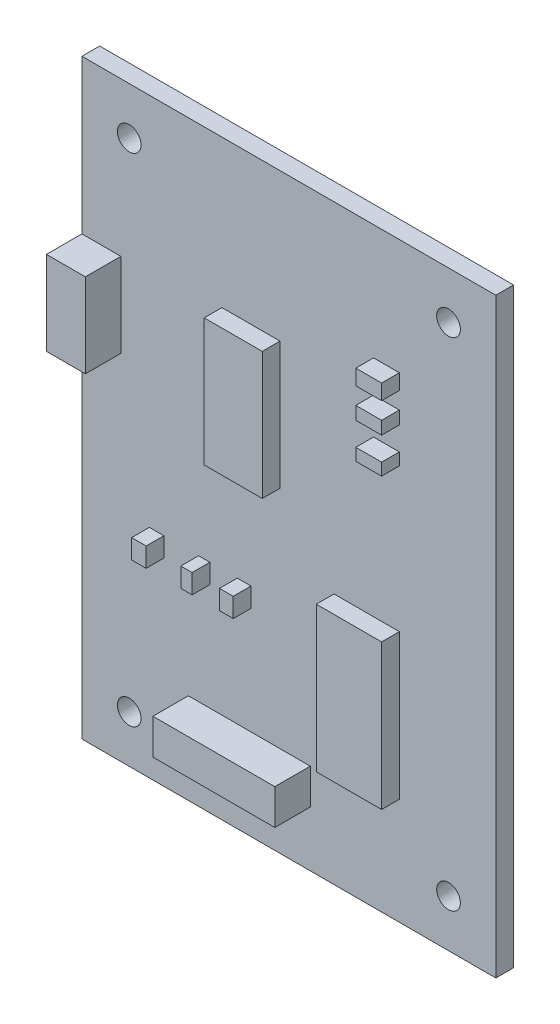
from build123d import *

# Parameters (mm, degrees)
SKETCH_1_W          = 70
SKETCH_1_H          = 100
EXTRUDE_1_DEPTH     = 3
SKETCH_2_R          = 2
CUT_EXTRUDE_1_DEPTH = 123.102416029
SKETCH_3_W          = 9.819716148
SKETCH_3_H          = 21.548821549
SKETCH_3_W_2        = 11.047180667
SKETCH_3_H_2        = 24.549290372
SKETCH_3_W_3        = 2.454929037
SKETCH_3_H_3        = 3.273238716
SKETCH_3_W_4        = 1.909389251
SKETCH_3_W_5        = 2.318544091
SKETCH_3_W_6        = 4.364318288
SKETCH_3_H_4        = 2.045774198
SKETCH_3_H_5        = 2.182159144
SKETCH_3_H_6        = 2.591313983
EXTRUDE_2_DEPTH     = 3
SKETCH_4_W          = 6.582292946
SKETCH_4_H          = 14.208853527
SKETCH_4_W_2        = 20.616767863
SKETCH_4_H_2        = 5.990006879
EXTRUDE_3_DEPTH     = 6


with BuildPart() as part:
    # Эскиз1 → Бобышка-Вытянуть1 (new body)
    with BuildSketch(Plane.XY):
        with Locations((35, 50)):
            Rectangle(SKETCH_1_W, SKETCH_1_H)
    extrude(amount=EXTRUDE_1_DEPTH)

    # Эскиз2 → Вырез-Вытянуть1 (cut, through all)
    with BuildSketch(Plane.XY.offset(3)):
        with Locations((8, 92)):
            Circle(SKETCH_2_R)
        with Locations((62, 92)):
            Circle(SKETCH_2_R)
        with Locations((62, 8)):
            Circle(SKETCH_2_R)
        with Locations((8, 8)):
            Circle(SKETCH_2_R)
    extrude(amount=-CUT_EXTRUDE_1_DEPTH, mode=Mode.SUBTRACT)

    # Эскиз3 → Бобышка-Вытянуть2 (add)
    with BuildSketch(Plane.XY.offset(3)):
        with Locations((28.589907514, 64.252226911)):
            Rectangle(SKETCH_3_W, SKETCH_3_H)
        with Locations((48.161147339, 30.292375229)):
            Rectangle(SKETCH_3_W_2, SKETCH_3_H_2)
        with Locations((12.632868773, 35.065848357)):
            Rectangle(SKETCH_3_W_3, SKETCH_3_H_3)
        with Locations((20.679580617, 35.065848357)):
            Rectangle(SKETCH_3_W_4, SKETCH_3_H_3)
        with Locations((27.430635469, 35.065848357)):
            Rectangle(SKETCH_3_W_5, SKETCH_3_H_3)
        with Locations((51.502578528, 67.866427993)):
            Rectangle(SKETCH_3_W_6, SKETCH_3_H_4)
        with Locations((51.502578528, 73.935558113)):
            Rectangle(SKETCH_3_W_6, SKETCH_3_H_5)
        with Locations((51.502578528, 79.186378554)):
            Rectangle(SKETCH_3_W_6, SKETCH_3_H_6)
    extrude(amount=EXTRUDE_2_DEPTH)

    # Эскиз4 → Бобышка-Вытянуть3 (add)
    with BuildSketch(Plane.XY.offset(3)):
        with Locations((3.291146473, 66.880429277)):
            Rectangle(SKETCH_4_W, SKETCH_4_H)
        with Locations((28.313480694, 12.343506182)):
            Rectangle(SKETCH_4_W_2, SKETCH_4_H_2)
    extrude(amount=EXTRUDE_3_DEPTH)


solid = part.part
